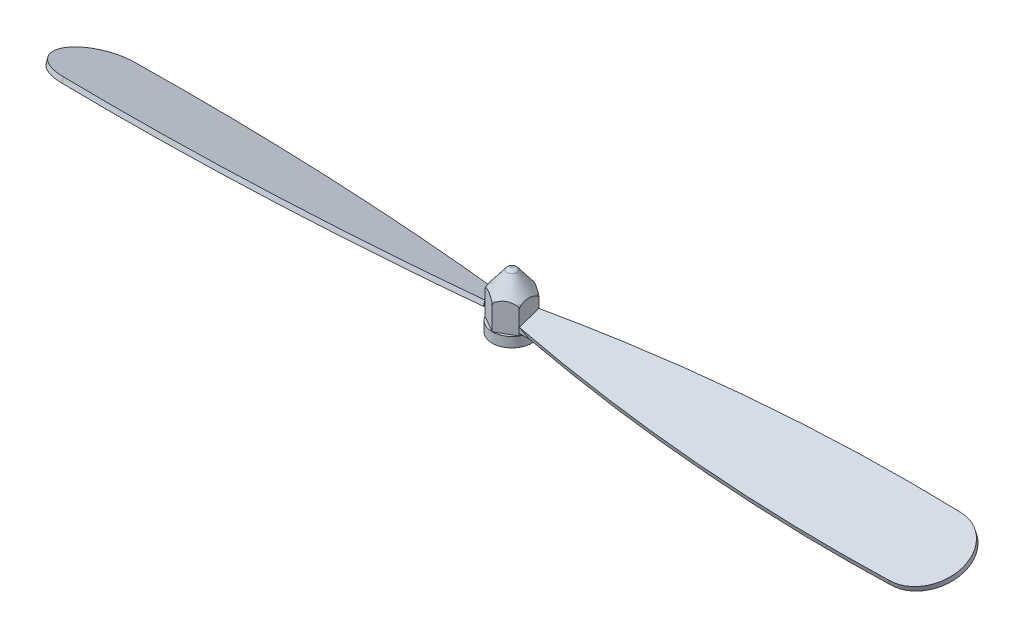
from build123d import *

# Parameters (mm, degrees)
CUT_EXTRUDE1_DEPTH  = 7.311586579
SKETCH3_R           = 1
CUT_EXTRUDE3_DEPTH  = 4
BOSS_EXTRUDE1_DEPTH = 40
SKETCH5_R           = 2
BOSS_EXTRUDE2_DEPTH = 1
CIRPATTERN1_COUNT   = 2
BOSS_EXTRUDE5_DEPTH = 0.5
CIRPATTERN2_COUNT   = 2
CIRPATTERN2_ANGLE   = 180


with BuildPart() as part:
    # Sketch1 → Revolve1 (revolve)
    with BuildSketch(Plane.XY):
        with BuildLine():
            Line((0, 3), (0, 5.64235093))
            Line((0, 5.64235093), (0.103984755, 5.64235093))
            ThreePointArc((0.103984755, 5.64235093), (0.324726661, 5.590985537), (0.500114588, 5.447442974))
            Line((0.500114588, 5.447442974), (1.896129833, 3.634864454))
            ThreePointArc((1.896129833, 3.634864454), (1.973320672, 3.490916884), (2, 3.32977241))
            Line((2, 3.32977241), (2, 3))
            Line((2, 3), (2, 0))
            Line((2, 0), (0, 0))
            Line((0, 0), (0, 3))
        make_face()
    revolve(axis=Axis((0, 0, 0), (0, 1, 0)))

    # Sketch2 → Cut-Extrude1 (cut, through all)
    with BuildSketch(Plane.XZ):
        with BuildLine():
            ThreePointArc((-1.732050808, -1), (-1, -1.732050808), (0, -2))
            Line((0, -2), (-1.732050808, -1))
        make_face()
        with BuildLine():
            Line((1.732050808, -1), (0, -2))
            ThreePointArc((0, -2), (1, -1.732050808), (1.732050808, -1))
        make_face()
        with BuildLine():
            Line((1.732050808, 1), (1.732050808, -1))
            ThreePointArc((1.732050808, -1), (2, 0), (1.732050808, 1))
        make_face()
        with BuildLine():
            ThreePointArc((-1.732050808, 1), (-2, 0), (-1.732050808, -1))
            Line((-1.732050808, -1), (-1.732050808, 1))
        make_face()
        with BuildLine():
            Line((0, 2), (1.732050808, 1))
            ThreePointArc((1.732050808, 1), (1, 1.732050808), (0, 2))
        make_face()
        with BuildLine():
            ThreePointArc((0, 2), (-1, 1.732050808), (-1.732050808, 1))
            Line((-1.732050808, 1), (0, 2))
        make_face()
    extrude(amount=-CUT_EXTRUDE1_DEPTH, mode=Mode.SUBTRACT)

    # Sketch3 → Cut-Extrude3 (cut)
    with BuildSketch(Plane.XZ):
        Circle(SKETCH3_R)
    extrude(amount=-CUT_EXTRUDE3_DEPTH, mode=Mode.SUBTRACT)

    # Sketch4 → Boss-Extrude1 (add)
    with BuildSketch(Plane(origin=(1.732050808, 0, 0), x_dir=(0, 0, -1), z_dir=(1, 0, 0))):
        Polygon((-1, 1.762865556), (1, 2.412704949), (1, 1.886973836), (-1, 1.237134444), align=None)
    boss_extrude1 = extrude(amount=BOSS_EXTRUDE1_DEPTH)

    # Sketch5 → Boss-Extrude2 (add)
    with BuildSketch(Plane(origin=(0, 0, 0), x_dir=(1, 0, 0), z_dir=(0, 1, 0))):
        Circle(SKETCH5_R)
    extrude(amount=BOSS_EXTRUDE2_DEPTH)

    # CirPattern1: Boss-Extrude1 ×2 about axis
    cirpattern1_axis = Axis((0, 0, 0), (0, 1, 0))
    for i in range(1, CIRPATTERN1_COUNT):
        add(boss_extrude1.rotate(cirpattern1_axis, i * 360 / CIRPATTERN1_COUNT))

    # Sketch7 → Boss-Extrude5 (add)
    with BuildSketch(Plane(origin=(0, 1.888419501, -0.613584691), x_dir=(1, 0, 0), z_dir=(1.072118069236029e-15, 0.9510565162951534, -0.30901699437494823))):
        with BuildLine():
            Line((-1.732050808, 0.406301101), (-1.732050808, -1.696623348))
            add(Edge.make_bspline(
                [(-1.732050808, -1.696623348), (-21.703698433, -4.932432586), (-41.732050808, -4.445161124)],
                knots=[0, 0, 0, 0.870359536, 0.870359536, 0.870359536], degree=2))
            ThreePointArc((-41.732050808, -4.445161124), (-45.532050808, -0.645161124), (-41.732050808, 3.154838876))
            add(Edge.make_bspline(
                [(-1.732050808, 0.406301101), (-21.703698433, 3.642110338), (-41.732050808, 3.154838876)],
                knots=[0, 0, 0, 0.870359536, 0.870359536, 0.870359536], degree=2))
        make_face()
    boss_extrude5 = extrude(amount=-BOSS_EXTRUDE5_DEPTH)

    # CirPattern2: Boss-Extrude5 ×2 about axis
    cirpattern2_axis = Axis((0, 0, 0), (0, 1, 0))
    for i in range(1, CIRPATTERN2_COUNT):
        add(boss_extrude5.rotate(cirpattern2_axis, i * CIRPATTERN2_ANGLE / (CIRPATTERN2_COUNT - 1)))


solid = part.part
